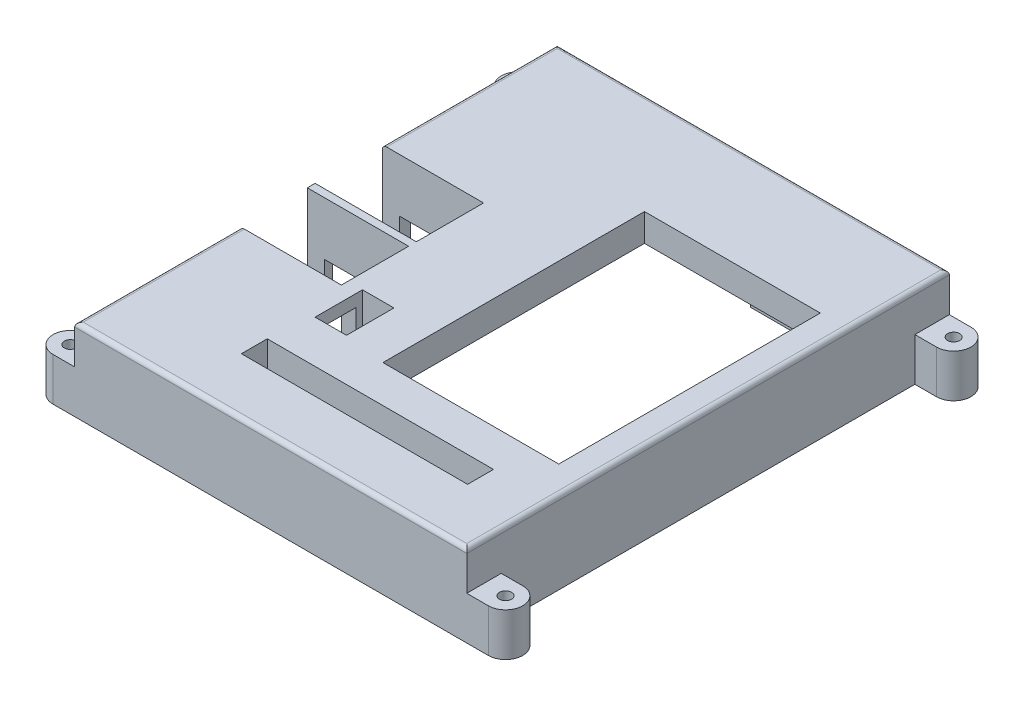
from build123d import *

# Parameters (mm, degrees)
SKETCH1_W                            = 91
SKETCH1_H                            = 112
BASE_DEPTH                           = 19
SKETCH2_R                            = 1.4
CASE_ASSEMBLY_HOLES_DEPTH            = 10
SKETCH3_W                            = 83
SKETCH3_H                            = 104
MODULE_CUTOUT_DEPTH                  = 6.6
USB_C_AND_MICRO_USB_SLOTS_DEPTH      = 117.176589724
USB_C_AND_MICRO_USB_SLOTS_DEPTH_BACK = 7
SKETCH4_W                            = 10.5
SKETCH4_H                            = 6
SKETCH4_W_2                          = 10
SKETCH5_W                            = 16.5
SKETCH5_H                            = 10
SKETCH5_W_2                          = 15.6
SKETCH5_H_2                          = 19
HDMI_AND_USB_SLOTS_DEPTH             = 23.5
SKETCH6_W                            = 17.9
SKETCH6_H                            = 16.2
ETHERNET_SLOT_DEPTH                  = 27
SKETCH7_R                            = 3.6
SKETCH7_W                            = 24
SKETCH7_H                            = 5
TALL_COMPONENTS_CUTOUTS_DEPTH        = 6
CASE_OPENINGS_REACH                  = 82.419
SKETCH8_W                            = 40.8
SKETCH8_H                            = 60.7
SKETCH8_W_2                          = 52.5
SKETCH8_H_2                          = 6
SKETCH8_W_3                          = 7.3
SKETCH8_H_3                          = 11
F_1MM_EDGE_FILLETS_R                 = 1


with BuildPart() as part:
    # Sketch1 → Base (new body)
    with BuildSketch(Plane(origin=(0, 0, 0), x_dir=(1, 0, 0), z_dir=(0, 1, 0))):
        Rectangle(SKETCH1_W, SKETCH1_H)
    extrude(amount=BASE_DEPTH)

    # Sketch2 → Case Assembly Holes (add)
    # profile 1 of 4: a face of its own
    with BuildSketch(Plane(origin=(0, 0, 0), x_dir=(1, 0, 0), z_dir=(0, 1, 0))):
        with BuildLine():
            Line((-45.5, 56), (-50.5, 56))
            ThreePointArc((-50.5, 56), (-54.5, 52), (-50.5, 48))
            Line((-50.5, 48), (-45.5, 48))
            Line((-45.5, 48), (-45.5, 56))
        make_face()
        with Locations((-50.5, 52)):
            Circle(SKETCH2_R, mode=Mode.SUBTRACT)
    # profile 2 of 4: a face of its own
    with BuildSketch(Plane(origin=(0, 0, 0), x_dir=(1, 0, 0), z_dir=(0, 1, 0))):
        with BuildLine():
            Line((45.5, 48), (50.5, 48))
            ThreePointArc((50.5, 48), (54.5, 52), (50.5, 56))
            Line((50.5, 56), (45.5, 56))
            Line((45.5, 56), (45.5, 48))
        make_face()
        with Locations((50.5, 52)):
            Circle(SKETCH2_R, mode=Mode.SUBTRACT)
    # profile 3 of 4: a face of its own
    with BuildSketch(Plane(origin=(0, 0, 0), x_dir=(1, 0, 0), z_dir=(0, 1, 0))):
        with BuildLine():
            Line((45.5, -56), (50.5, -56))
            ThreePointArc((50.5, -56), (54.5, -52), (50.5, -48))
            Line((50.5, -48), (45.5, -48))
            Line((45.5, -48), (45.5, -56))
        make_face()
        with Locations((50.5, -52)):
            Circle(SKETCH2_R, mode=Mode.SUBTRACT)
    # profile 4 of 4: a face of its own
    with BuildSketch(Plane(origin=(0, 0, 0), x_dir=(1, 0, 0), z_dir=(0, 1, 0))):
        with BuildLine():
            Line((-45.5, -48), (-50.5, -48))
            ThreePointArc((-50.5, -48), (-54.5, -52), (-50.5, -56))
            Line((-50.5, -56), (-45.5, -56))
            Line((-45.5, -56), (-45.5, -48))
        make_face()
        with Locations((-50.5, -52)):
            Circle(SKETCH2_R, mode=Mode.SUBTRACT)
    extrude(amount=CASE_ASSEMBLY_HOLES_DEPTH)

    # Sketch3 → Module Cutout (cut)
    with BuildSketch(Plane.XZ):
        Rectangle(SKETCH3_W, SKETCH3_H)
    extrude(amount=-MODULE_CUTOUT_DEPTH, mode=Mode.SUBTRACT)

    # Sketch4 → USB-C and Micro-USB Slots (cut, two sides: drawn at the far end of the back side and taken through both)
    with BuildSketch(Plane.ZY.offset(45.5).offset(-USB_C_AND_MICRO_USB_SLOTS_DEPTH_BACK)):
        with Locations((-44, 3)):
            Rectangle(SKETCH4_W, SKETCH4_H)
        with Locations((42, 3)):
            Rectangle(SKETCH4_W_2, SKETCH4_H)
    extrude(amount=USB_C_AND_MICRO_USB_SLOTS_DEPTH + USB_C_AND_MICRO_USB_SLOTS_DEPTH_BACK, mode=Mode.SUBTRACT)

    # Sketch5 → HDMI and USB Slots (cut)
    with BuildSketch(Plane.ZY.offset(45.5)):
        with Locations((-26.25, 5)):
            Rectangle(SKETCH5_W, SKETCH5_H)
        with Locations((-7.6, 9.5)):
            Rectangle(SKETCH5_W_2, SKETCH5_H_2)
        with Locations((9.8, 9.5)):
            Rectangle(SKETCH5_W_2, SKETCH5_H_2)
    extrude(amount=-HDMI_AND_USB_SLOTS_DEPTH, mode=Mode.SUBTRACT)

    # Sketch6 → Ethernet Slot (cut)
    with BuildSketch(Plane.ZY.offset(45.5)):
        with Locations((26.55, 8.1)):
            Rectangle(SKETCH6_W, SKETCH6_H)
    extrude(amount=-ETHERNET_SLOT_DEPTH, mode=Mode.SUBTRACT)

    # Sketch7 → Tall Components Cutouts (cut)
    with BuildSketch(Plane.XZ.offset(-6.6)):
        with Locations((-20.05, -12.75)):
            Circle(SKETCH7_R)
        with Locations((-15.25, 32.09)):
            Circle(SKETCH7_R)
        with Locations((6.5, -46.25)):
            Rectangle(SKETCH7_W, SKETCH7_H)
        Polygon((17.5, 33.8), (42.5, 33.8), (42.5, -37.8), (17.5, -37.8), (17.5, -41.8), (-11.5, -41.8), (-11.5, 37.8), (17.5, 37.8), align=None)
    extrude(amount=-TALL_COMPONENTS_CUTOUTS_DEPTH, mode=Mode.SUBTRACT)

    # Sketch8 → Case Openings (cut, up to next)
    with BuildSketch(Plane(origin=(0, 19, 0), x_dir=(1, 0, 0), z_dir=(0, 1, 0)), mode=Mode.PRIVATE) as case_openings_sk1:
        with Locations((18.8, 2)):
            Rectangle(SKETCH8_W, SKETCH8_H)
    case_openings_tool1 = extrude(case_openings_sk1.sketch, amount=-CASE_OPENINGS_REACH, mode=Mode.PRIVATE) & part.part
    # Sketch8 → Case Openings (cut, up to next)
    with BuildSketch(Plane(origin=(0, 19, 0), x_dir=(1, 0, 0), z_dir=(0, 1, 0)), mode=Mode.PRIVATE) as case_openings_sk2:
        with Locations((6.45, -40)):
            Rectangle(SKETCH8_W_2, SKETCH8_H_2)
    case_openings_tool2 = extrude(case_openings_sk2.sketch, amount=-CASE_OPENINGS_REACH, mode=Mode.PRIVATE) & part.part
    # Sketch8 → Case Openings (cut, up to next)
    with BuildSketch(Plane(origin=(0, 19, 0), x_dir=(1, 0, 0), z_dir=(0, 1, 0)), mode=Mode.PRIVATE) as case_openings_sk3:
        with Locations((-14.95, -21.6)):
            Rectangle(SKETCH8_W_3, SKETCH8_H_3)
    case_openings_tool3 = extrude(case_openings_sk3.sketch, amount=-CASE_OPENINGS_REACH, mode=Mode.PRIVATE) & part.part
    add(case_openings_tool1.solids().sort_by_distance((18.8, 19, -2))[0], mode=Mode.SUBTRACT)
    add(case_openings_tool2.solids().sort_by_distance((6.45, 19, 40))[0], mode=Mode.SUBTRACT)
    add(case_openings_tool3.solids().sort_by_distance((-14.95, 19, 21.6))[0], mode=Mode.SUBTRACT)

    # 1mm Edge Fillets
    f_1mm_edge_fillets_edges = [part.edges().sort_by_distance(p)[0] for p in [
        (-45.5, 19, 36.8),
        (0, 19, 56),
        (45.5, 19, 0),
        (-45.5, 19, -35.7),
        (0, 19, -56),
    ]]
    fillet(f_1mm_edge_fillets_edges, radius=F_1MM_EDGE_FILLETS_R)


solid = part.part
